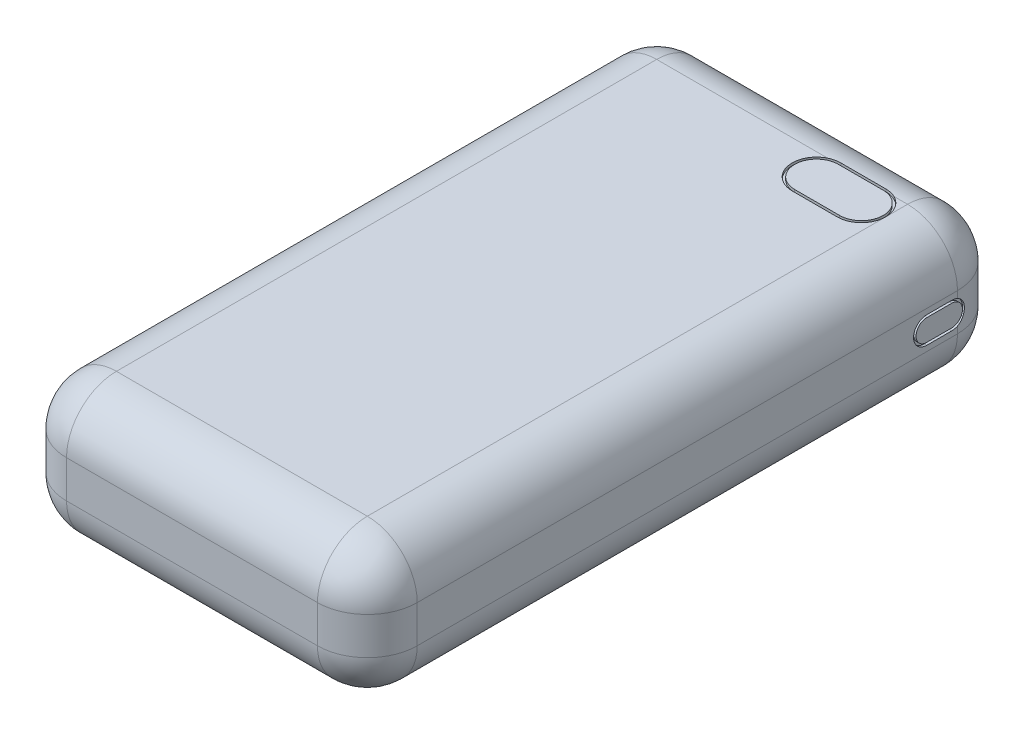
from build123d import *

# Parameters (mm, degrees)
SKETCH1_W           = 70.3
SKETCH1_H           = 128.3
BOSS_EXTRUDE1_DEPTH = 27.5
FILLET1_R           = 10
CUT_EXTRUDE1_START  = 35.15
CUT_EXTRUDE1_DEPTH  = 0.5
CUT_EXTRUDE2_DEPTH  = 0.5
FILLET2_R           = 10
CUT_EXTRUDE3_DEPTH  = 0.25


with BuildPart() as part:
    # Sketch1 → Boss-Extrude1 (new body)
    with BuildSketch(Plane(origin=(0, 0, 0), x_dir=(1, 0, 0), z_dir=(0, 1, 0))):
        Rectangle(SKETCH1_W, SKETCH1_H)
    extrude(amount=BOSS_EXTRUDE1_DEPTH)

    # Fillet1
    fillet1_edges = [part.edges().sort_by_distance(p)[0] for p in [
        (-35.15, 27.5, 0),
        (0, 27.5, 64.15),
        (35.15, 27.5, 0),
        (0, 0, 64.15),
        (-35.15, 0, 0),
        (0, 0, -64.15),
        (35.15, 0, 0),
        (0, 27.5, -64.15),
    ]]
    fillet(fillet1_edges, radius=FILLET1_R)

    # Sketch2 → Cut-Extrude1 (cut)
    with BuildSketch(Plane(origin=(0, 0, 0), x_dir=(0, 0, -1), z_dir=(1, 0, 0)).offset(CUT_EXTRUDE1_START)):
        with BuildLine():
            Line((48, 16.4), (53, 16.4))
            ThreePointArc((53, 16.4), (55.65, 13.75), (53, 11.1))
            Line((53, 11.1), (48, 11.1))
            ThreePointArc((48, 11.1), (45.35, 13.75), (48, 16.4))
        make_face()
        with BuildLine():
            Line((48, 15.9), (53, 15.9))
            ThreePointArc((53, 15.9), (55.15, 13.75), (53, 11.6))
            Line((53, 11.6), (48, 11.6))
            ThreePointArc((48, 11.6), (45.85, 13.75), (48, 15.9))
        make_face(mode=Mode.SUBTRACT)
    extrude(amount=-CUT_EXTRUDE1_DEPTH, mode=Mode.SUBTRACT)

    # Sketch3 → Cut-Extrude2 (cut)
    with BuildSketch(Plane(origin=(0, 27.5, 0), x_dir=(1, 0, 0), z_dir=(0, 1, 0))):
        with BuildLine():
            Line((11.275, 54.65), (20.275, 54.65))
            ThreePointArc((20.275, 54.65), (25.15, 49.775), (20.275, 44.9))
            Line((20.275, 44.9), (11.275, 44.9))
            ThreePointArc((11.275, 44.9), (6.4, 49.775), (11.275, 54.65))
        make_face()
        with BuildLine():
            Line((11.275, 54.15), (20.275, 54.15))
            ThreePointArc((20.275, 54.15), (24.65, 49.775), (20.275, 45.4))
            Line((20.275, 45.4), (11.275, 45.4))
            ThreePointArc((11.275, 45.4), (6.9, 49.775), (11.275, 54.15))
        make_face(mode=Mode.SUBTRACT)
    extrude(amount=-CUT_EXTRUDE2_DEPTH, mode=Mode.SUBTRACT)

    # Fillet2
    # the kernel refuses this fillet: 10 mm, written as the material it takes off along each edge
    with BuildSketch(Plane(origin=(25.15, 10, 54.15), x_dir=(0, 0, 1), z_dir=(1, 0, 0))) as fillet2_piece_1_section:
        Polygon((0, 0), (FILLET2_R * 1.02, 0), (FILLET2_R * 1.02, FILLET2_R * 1.02), (0, FILLET2_R * 1.02), align=None)
    fillet2_piece_1 = extrude(amount=FILLET2_R * 1.02, mode=Mode.PRIVATE)
    fillet2_piece_1 = fillet2_piece_1 - Plane(origin=(25.15, 10, 54.15), x_dir=(0, 0.7071067811865475, -0.7071067811865475), z_dir=(1, 0, 0)) * Sphere(FILLET2_R, mode=Mode.PRIVATE)
    add(fillet2_piece_1, mode=Mode.SUBTRACT)
    with BuildSketch(Plane(origin=(-25.15, 10, 54.15), x_dir=(0, 0, 1), z_dir=(-1, 0, 0))) as fillet2_piece_2_section:
        Polygon((0, 0), (FILLET2_R * 1.02, 0), (FILLET2_R * 1.02, -FILLET2_R * 1.02), (0, -FILLET2_R * 1.02), align=None)
    fillet2_piece_2 = extrude(amount=FILLET2_R * 1.02, mode=Mode.PRIVATE)
    fillet2_piece_2 = fillet2_piece_2 - Plane(origin=(-25.15, 10, 54.15), x_dir=(0, 0.7071067811865475, -0.7071067811865475), z_dir=(-1, 0, 0)) * Sphere(FILLET2_R, mode=Mode.PRIVATE)
    add(fillet2_piece_2, mode=Mode.SUBTRACT)
    with BuildSketch(Plane(origin=(25.15, 10, -54.15), x_dir=(1, 0, 0), z_dir=(0, 0, -1))) as fillet2_piece_3_section:
        Polygon((0, 0), (FILLET2_R * 1.02, 0), (FILLET2_R * 1.02, FILLET2_R * 1.02), (0, FILLET2_R * 1.02), align=None)
    fillet2_piece_3 = extrude(amount=FILLET2_R * 1.02, mode=Mode.PRIVATE)
    fillet2_piece_3 = fillet2_piece_3 - Plane(origin=(25.15, 10, -54.15), x_dir=(-0.7071067811865475, 0.7071067811865475, 0), z_dir=(0, 0, -1)) * Sphere(FILLET2_R, mode=Mode.PRIVATE)
    add(fillet2_piece_3, mode=Mode.SUBTRACT)
    with BuildSketch(Plane(origin=(-25.15, 10, -54.15), x_dir=(-1, 0, 0), z_dir=(0, 0, -1))) as fillet2_piece_4_section:
        Polygon((0, 0), (FILLET2_R * 1.02, 0), (FILLET2_R * 1.02, -FILLET2_R * 1.02), (0, -FILLET2_R * 1.02), align=None)
    fillet2_piece_4 = extrude(amount=FILLET2_R * 1.02, mode=Mode.PRIVATE)
    fillet2_piece_4 = fillet2_piece_4 - Plane(origin=(-25.15, 10, -54.15), x_dir=(0.7071067811865475, 0.7071067811865475, 0), z_dir=(0, 0, -1)) * Sphere(FILLET2_R, mode=Mode.PRIVATE)
    add(fillet2_piece_4, mode=Mode.SUBTRACT)
    with BuildSketch(Plane(origin=(-25.15, 17.5, -54.15), x_dir=(-1, 0, 0), z_dir=(0, 0, -1))) as fillet2_piece_5_section:
        Polygon((0, 0), (FILLET2_R * 1.02, 0), (FILLET2_R * 1.02, FILLET2_R * 1.02), (0, FILLET2_R * 1.02), align=None)
    fillet2_piece_5 = extrude(amount=FILLET2_R * 1.02, mode=Mode.PRIVATE)
    fillet2_piece_5 = fillet2_piece_5 - Plane(origin=(-25.15, 17.5, -54.15), x_dir=(0.7071067811865475, -0.7071067811865475, 0), z_dir=(0, 0, -1)) * Sphere(FILLET2_R, mode=Mode.PRIVATE)
    add(fillet2_piece_5, mode=Mode.SUBTRACT)
    with BuildSketch(Plane(origin=(25.15, 17.5, -54.15), x_dir=(1, 0, 0), z_dir=(0, 0, -1))) as fillet2_piece_6_section:
        Polygon((0, 0), (FILLET2_R * 1.02, 0), (FILLET2_R * 1.02, -FILLET2_R * 1.02), (0, -FILLET2_R * 1.02), align=None)
    fillet2_piece_6 = extrude(amount=FILLET2_R * 1.02, mode=Mode.PRIVATE)
    fillet2_piece_6 = fillet2_piece_6 - Plane(origin=(25.15, 17.5, -54.15), x_dir=(-0.7071067811865475, -0.7071067811865475, 0), z_dir=(0, 0, -1)) * Sphere(FILLET2_R, mode=Mode.PRIVATE)
    add(fillet2_piece_6, mode=Mode.SUBTRACT)
    with BuildSketch(Plane(origin=(-25.15, 17.5, 54.15), x_dir=(0, 0, 1), z_dir=(-1, 0, 0))) as fillet2_piece_7_section:
        Polygon((0, 0), (FILLET2_R * 1.02, 0), (FILLET2_R * 1.02, FILLET2_R * 1.02), (0, FILLET2_R * 1.02), align=None)
    fillet2_piece_7 = extrude(amount=FILLET2_R * 1.02, mode=Mode.PRIVATE)
    fillet2_piece_7 = fillet2_piece_7 - Plane(origin=(-25.15, 17.5, 54.15), x_dir=(0, -0.7071067811865475, -0.7071067811865475), z_dir=(-1, 0, 0)) * Sphere(FILLET2_R, mode=Mode.PRIVATE)
    add(fillet2_piece_7, mode=Mode.SUBTRACT)
    with BuildSketch(Plane(origin=(25.15, 17.5, 54.15), x_dir=(0, 0, 1), z_dir=(1, 0, 0))) as fillet2_piece_8_section:
        Polygon((0, 0), (FILLET2_R * 1.02, 0), (FILLET2_R * 1.02, -FILLET2_R * 1.02), (0, -FILLET2_R * 1.02), align=None)
    fillet2_piece_8 = extrude(amount=FILLET2_R * 1.02, mode=Mode.PRIVATE)
    fillet2_piece_8 = fillet2_piece_8 - Plane(origin=(25.15, 17.5, 54.15), x_dir=(0, -0.7071067811865475, -0.7071067811865475), z_dir=(1, 0, 0)) * Sphere(FILLET2_R, mode=Mode.PRIVATE)
    add(fillet2_piece_8, mode=Mode.SUBTRACT)
    with BuildSketch(Plane(origin=(-35.15, 10, -64.15), x_dir=(1, 0, 0), z_dir=(0, 1, 0)), Plane(origin=(-35.15, 10, 64.15), x_dir=(0, 0, -1), z_dir=(0, 1, 0))) as fillet2_piece_9:
        with BuildLine():
            CenterArc((FILLET2_R, -FILLET2_R), FILLET2_R, 90, 90)
            Line((0, -FILLET2_R), (0, 0))
            Line((0, 0), (FILLET2_R, 0))
        make_face()
    extrude(amount=7.5, mode=Mode.SUBTRACT)
    with BuildSketch(Plane(origin=(35.15, 10, -64.15), x_dir=(-1, 0, 0), z_dir=(0, 1, 0))) as fillet2_piece_10_section:
        with BuildLine():
            CenterArc((FILLET2_R, FILLET2_R), FILLET2_R, 180, 90)
            Line((0, FILLET2_R), (0, 0))
            Line((0, 0), (FILLET2_R, 0))
        make_face()
    fillet2_piece_10 = extrude(amount=7.5, mode=Mode.PRIVATE)
    fillet2_piece_10 = fillet2_piece_10 - Plane(origin=(30.454991339, 13.75, -53), x_dir=(0, 1, 0), z_dir=(1, 0, 0)) * Cylinder(2.15, 55, mode=Mode.PRIVATE)
    add(fillet2_piece_10, mode=Mode.SUBTRACT)
    with BuildSketch(Plane(origin=(35.15, 10, 64.15), x_dir=(0, 0, -1), z_dir=(0, 1, 0))) as fillet2_piece_11:
        with BuildLine():
            CenterArc((FILLET2_R, FILLET2_R), FILLET2_R, 180, 90)
            Line((0, FILLET2_R), (0, 0))
            Line((0, 0), (FILLET2_R, 0))
        make_face()
    extrude(amount=7.5, mode=Mode.SUBTRACT)

    # Sketch4 → Cut-Extrude3 (cut)
    with BuildSketch(Plane(origin=(0, 0, -64.15), x_dir=(-1, 0, 0), z_dir=(0, 0, -1))):
        with BuildLine():
            Line((-3.8, 15.35), (2, 15.35))
            ThreePointArc((2, 15.35), (3.6, 13.75), (2, 12.15))
            Line((2, 12.15), (-3.8, 12.15))
            ThreePointArc((-3.8, 12.15), (-5.4, 13.75), (-3.8, 15.35))
        make_face()
        with BuildLine():
            Line((-3.8, 15.1), (2, 15.1))
            ThreePointArc((2, 15.1), (3.35, 13.75), (2, 12.4))
            Line((2, 12.4), (-3.8, 12.4))
            ThreePointArc((-3.8, 12.4), (-5.15, 13.75), (-3.8, 15.1))
        make_face(mode=Mode.SUBTRACT)
    extrude(amount=-CUT_EXTRUDE3_DEPTH, mode=Mode.SUBTRACT)


solid = part.part
